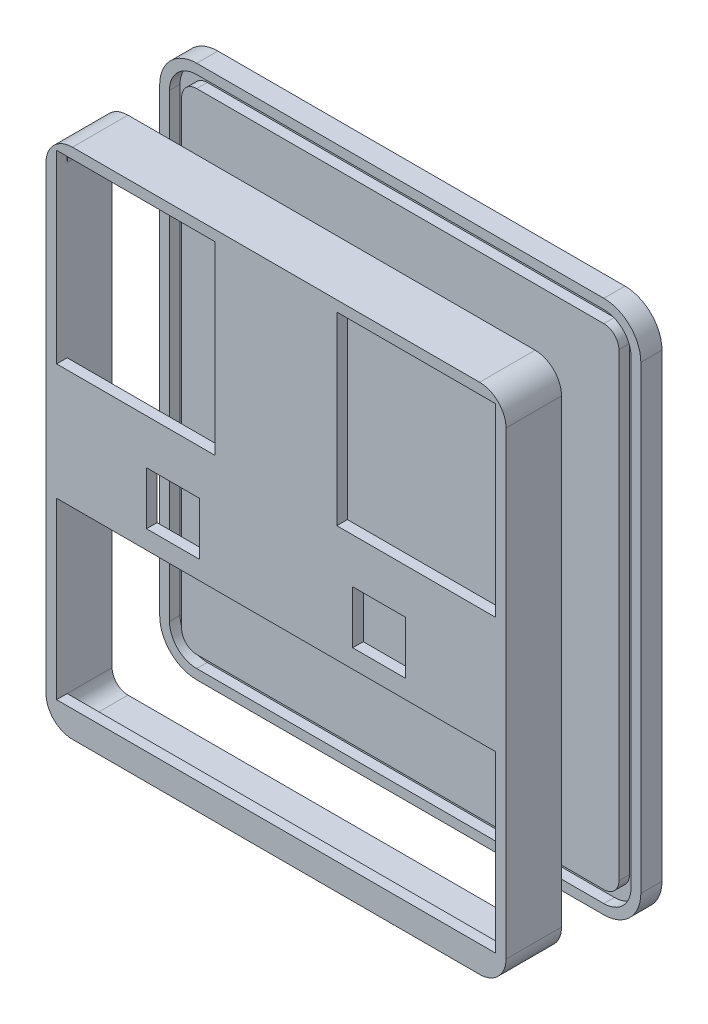
from build123d import *

# Parameters (mm, degrees)
SKETCH1_W           = 87
SKETCH1_H           = 97
BOSS_EXTRUDE1_DEPTH = 8.5
FILLET1_R           = 5
SHELL1_T            = -2
CUT_EXTRUDE1_REACH  = 67.473
SKETCH2_W           = 30
SKETCH2_H           = 35
SKETCH2_W_2         = 10
SKETCH2_H_2         = 10
SKETCH2_W_3         = 83
SKETCH2_H_3         = 33
BOSS_EXTRUDE2_DEPTH = 4
CUT_EXTRUDE2_DEPTH  = 2
BOSS_EXTRUDE3_DEPTH = 2


with BuildPart() as part:
    # Sketch1 → Boss-Extrude1 (new body)
    with BuildSketch(Plane.XY):
        Rectangle(SKETCH1_W, SKETCH1_H)
    extrude(amount=BOSS_EXTRUDE1_DEPTH)

    # Fillet1
    fillet1_edges = [part.edges().sort_by_distance(p)[0] for p in [
        (43.5, -48.5, 4.25),
        (-43.5, -48.5, 4.25),
        (-43.5, 48.5, 4.25),
        (43.5, 48.5, 4.25),
    ]]
    fillet(fillet1_edges, radius=FILLET1_R)

    # Shell1
    shell1_openings = [part.faces().sort_by_distance(p)[0] for p in [
        (0, 0, 0),
    ]]
    offset(amount=SHELL1_T, openings=shell1_openings, kind=Kind.INTERSECTION)

    # Sketch2 → Cut-Extrude1 (cut, up to next)
    with BuildSketch(Plane(origin=(0, 0, 6.5), x_dir=(-1, 0, 0), z_dir=(0, 0, -1)), mode=Mode.PRIVATE) as cut_extrude1_sk1:
        with Locations((26.5, 29)):
            Rectangle(SKETCH2_W, SKETCH2_H)
    cut_extrude1_tool1 = extrude(cut_extrude1_sk1.sketch, amount=-CUT_EXTRUDE1_REACH, mode=Mode.PRIVATE) & part.part
    # Sketch2 → Cut-Extrude1 (cut, up to next)
    with BuildSketch(Plane(origin=(0, 0, 6.5), x_dir=(-1, 0, 0), z_dir=(0, 0, -1)), mode=Mode.PRIVATE) as cut_extrude1_sk2:
        with Locations((-26.5, 29)):
            Rectangle(SKETCH2_W, SKETCH2_H)
    cut_extrude1_tool2 = extrude(cut_extrude1_sk2.sketch, amount=-CUT_EXTRUDE1_REACH, mode=Mode.PRIVATE) & part.part
    # Sketch2 → Cut-Extrude1 (cut, up to next)
    with BuildSketch(Plane(origin=(0, 0, 6.5), x_dir=(-1, 0, 0), z_dir=(0, 0, -1)), mode=Mode.PRIVATE) as cut_extrude1_sk3:
        with Locations((-19.5, -2)):
            Rectangle(SKETCH2_W_2, SKETCH2_H_2)
    cut_extrude1_tool3 = extrude(cut_extrude1_sk3.sketch, amount=-CUT_EXTRUDE1_REACH, mode=Mode.PRIVATE) & part.part
    # Sketch2 → Cut-Extrude1 (cut, up to next)
    with BuildSketch(Plane(origin=(0, 0, 6.5), x_dir=(-1, 0, 0), z_dir=(0, 0, -1)), mode=Mode.PRIVATE) as cut_extrude1_sk4:
        with Locations((19.5, -2)):
            Rectangle(SKETCH2_W_2, SKETCH2_H_2)
    cut_extrude1_tool4 = extrude(cut_extrude1_sk4.sketch, amount=-CUT_EXTRUDE1_REACH, mode=Mode.PRIVATE) & part.part
    # Sketch2 → Cut-Extrude1 (cut, up to next)
    with BuildSketch(Plane(origin=(0, 0, 6.5), x_dir=(-1, 0, 0), z_dir=(0, 0, -1)), mode=Mode.PRIVATE) as cut_extrude1_sk5:
        with Locations((0, -27)):
            Rectangle(SKETCH2_W_3, SKETCH2_H_3)
    cut_extrude1_tool5 = extrude(cut_extrude1_sk5.sketch, amount=-CUT_EXTRUDE1_REACH, mode=Mode.PRIVATE) & part.part
    add(cut_extrude1_tool1.solids().sort_by_distance((-26.5, 29, 6.5))[0], mode=Mode.SUBTRACT)
    add(cut_extrude1_tool2.solids().sort_by_distance((26.5, 29, 6.5))[0], mode=Mode.SUBTRACT)
    add(cut_extrude1_tool3.solids().sort_by_distance((19.5, -2, 6.5))[0], mode=Mode.SUBTRACT)
    add(cut_extrude1_tool4.solids().sort_by_distance((-19.5, -2, 6.5))[0], mode=Mode.SUBTRACT)
    add(cut_extrude1_tool5.solids().sort_by_distance((0, -27, 6.5))[0], mode=Mode.SUBTRACT)

    # Sketch5 → Boss-Extrude3 (add)
    with BuildSketch(Plane(origin=(0, 0, 0), x_dir=(-1, 0, 0), z_dir=(0, 0, -1))):
        with BuildLine():
            Line((-43.5, 43.5), (-43.5, -43.5))
            ThreePointArc((-43.5, -43.5), (-42.035533906, -47.035533906), (-38.5, -48.5))
            Line((-38.5, -48.5), (38.5, -48.5))
            ThreePointArc((38.5, -48.5), (42.035533906, -47.035533906), (43.5, -43.5))
            Line((43.5, -43.5), (43.5, 43.5))
            ThreePointArc((43.5, 43.5), (42.035533906, 47.035533906), (38.5, 48.5))
            Line((38.5, 48.5), (-38.5, 48.5))
            ThreePointArc((-38.5, 48.5), (-42.035533906, 47.035533906), (-43.5, 43.5))
        make_face()
        with BuildLine():
            Line((38.5, -46.5), (-38.5, -46.5))
            ThreePointArc((-38.5, -46.5), (-40.621320344, -45.621320344), (-41.5, -43.5))
            Line((-41.5, -43.5), (-41.5, 43.5))
            ThreePointArc((-41.5, 43.5), (-40.621320344, 45.621320344), (-38.5, 46.5))
            Line((-38.5, 46.5), (38.5, 46.5))
            ThreePointArc((38.5, 46.5), (40.621320344, 45.621320344), (41.5, 43.5))
            Line((41.5, 43.5), (41.5, -43.5))
            ThreePointArc((41.5, -43.5), (40.621320344, -45.621320344), (38.5, -46.5))
        make_face(mode=Mode.SUBTRACT)
    extrude(amount=BOSS_EXTRUDE3_DEPTH)


with BuildPart() as body_2:
    # Sketch3 → Boss-Extrude2 (new body)
    with BuildSketch(Plane(origin=(0, 0, -15), x_dir=(-1, 0, 0), z_dir=(0, 0, -1))):
        with BuildLine():
            Line((-45.5, 43.5), (-45.5, -43.5))
            ThreePointArc((-45.5, -43.5), (-43.449747468, -48.449747468), (-38.5, -50.5))
            Line((-38.5, -50.5), (38.5, -50.5))
            ThreePointArc((38.5, -50.5), (43.449747468, -48.449747468), (45.5, -43.5))
            Line((45.5, -43.5), (45.5, 43.5))
            ThreePointArc((45.5, 43.5), (43.449747468, 48.449747468), (38.5, 50.5))
            Line((38.5, 50.5), (-38.5, 50.5))
            ThreePointArc((-38.5, 50.5), (-43.449747468, 48.449747468), (-45.5, 43.5))
        make_face()
    extrude(amount=BOSS_EXTRUDE2_DEPTH)

    # Sketch4 → Cut-Extrude2 (cut)
    with BuildSketch(Plane.XY.offset(-15)):
        with BuildLine():
            Line((38.5, 48.65), (-38.5, 48.65))
            ThreePointArc((-38.5, 48.65), (-42.141599923, 47.141599923), (-43.65, 43.5))
            Line((-43.65, 43.5), (-43.65, -43.5))
            ThreePointArc((-43.65, -43.5), (-42.141599923, -47.141599923), (-38.5, -48.65))
            Line((-38.5, -48.65), (38.5, -48.65))
            ThreePointArc((38.5, -48.65), (42.141599923, -47.141599923), (43.65, -43.5))
            Line((43.65, -43.5), (43.65, 43.5))
            ThreePointArc((43.65, 43.5), (42.141599923, 47.141599923), (38.5, 48.65))
        make_face()
        with BuildLine():
            Line((38.5, 46.35), (-38.5, 46.35))
            ThreePointArc((-38.5, 46.35), (-40.515254326, 45.515254326), (-41.35, 43.5))
            Line((-41.35, 43.5), (-41.35, -43.5))
            ThreePointArc((-41.35, -43.5), (-40.515254326, -45.515254326), (-38.5, -46.35))
            Line((-38.5, -46.35), (38.5, -46.35))
            ThreePointArc((38.5, -46.35), (40.515254326, -45.515254326), (41.35, -43.5))
            Line((41.35, -43.5), (41.35, 43.5))
            ThreePointArc((41.35, 43.5), (40.515254326, 45.515254326), (38.5, 46.35))
        make_face(mode=Mode.SUBTRACT)
    extrude(amount=-CUT_EXTRUDE2_DEPTH, mode=Mode.SUBTRACT)


solid = Compound([part.part, body_2.part])
